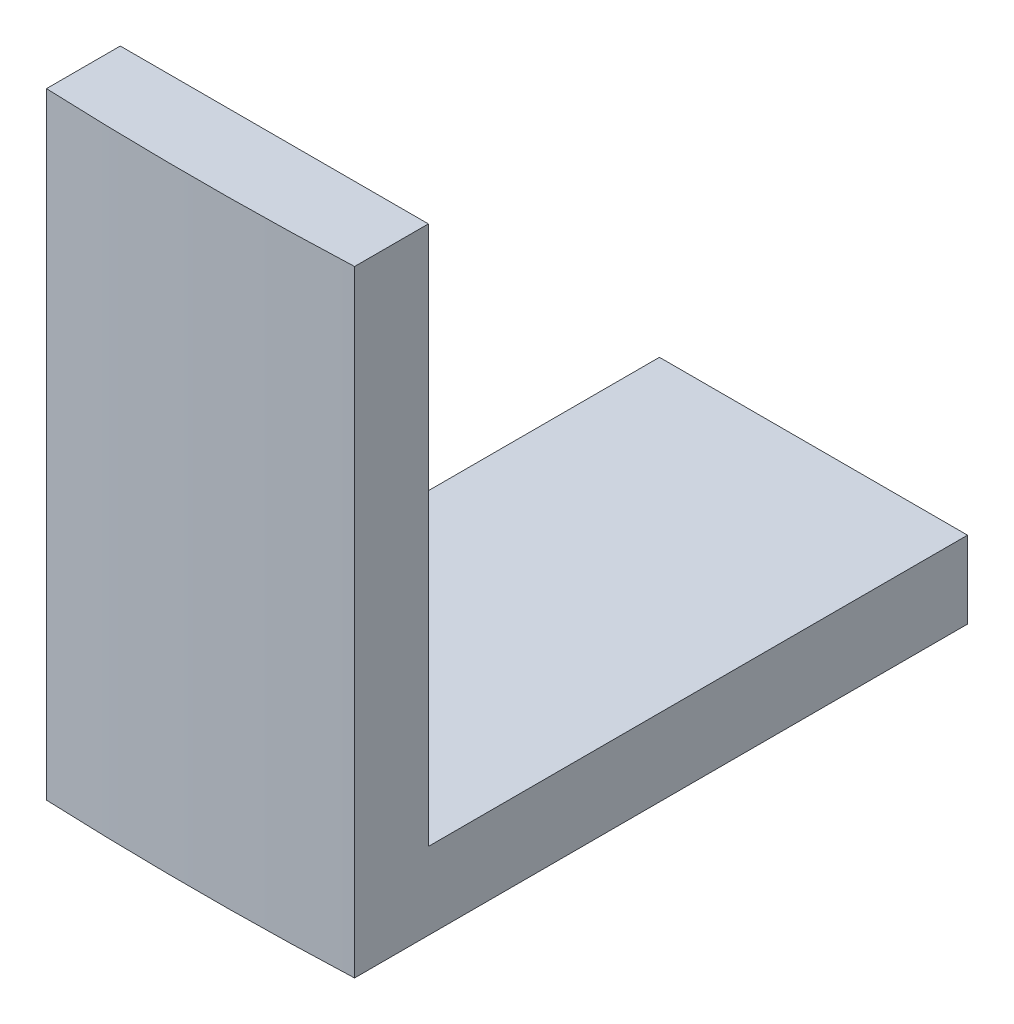
from build123d import *

# Parameters (mm, degrees)
BOSS_EXTRUDE1_DEPTH = 6.35
CUT_EXTRUDE1_START  = -12.7
CUT_EXTRUDE1_DEPTH  = 12.7


# Read off the part's stored shape, not the designer's step: Cut-Extrude1
with BuildPart() as part:
    # Sketch1 → Boss-Extrude1 (new body)
    with BuildSketch(Plane(origin=(0, 0, 0), x_dir=(0, 0, -1), z_dir=(1, 0, 0))):
        Polygon((0, 0), (12.7, 0), (12.7, 1.5875), (1.5875, 1.5875), (1.5875, 12.7), (0, 12.7), align=None)
    extrude(amount=BOSS_EXTRUDE1_DEPTH)

    # Cut-Extrude1 outline → Cut-Extrude1 (cut)
    with BuildSketch(Plane(origin=(0, 12.7, 0), x_dir=(1, 0, 0), z_dir=(0, 1, 0)).offset(CUT_EXTRUDE1_START)):
        with BuildLine():
            ThreePointArc((6.35, 0.066174567), (4.762844565, 0.016545434), (3.174999586, 0))
            Line((3.174999586, 0), (6.35, 0))
            Line((6.35, 0), (6.35, 0.066174567))
        make_face()
        with BuildLine():
            ThreePointArc((3.174999586, 0), (1.587155022, 0.016545442), (0, 0.066174567))
            Line((0, 0.066174567), (0, 0))
            Line((0, 0), (3.174999586, 0))
        make_face()
    extrude(amount=CUT_EXTRUDE1_DEPTH, mode=Mode.SUBTRACT)


solid = part.part
